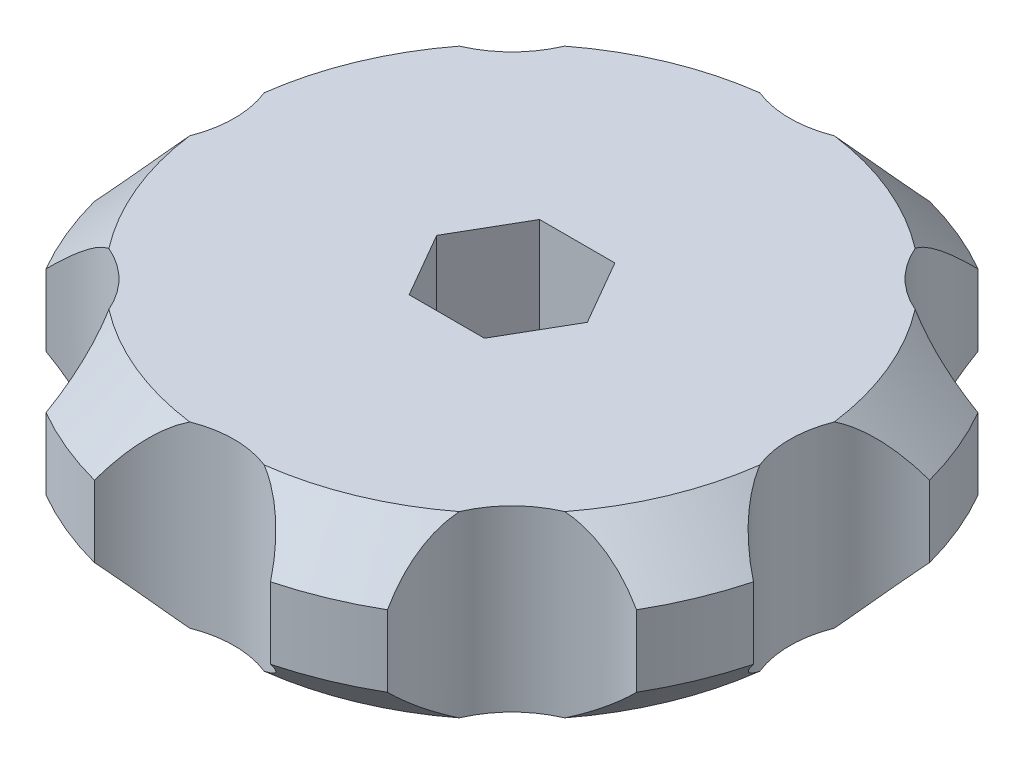
from build123d import *

# Parameters (mm, degrees)
BOSS_EXTRUDE1_DEPTH = 10
CHAMFER1_SIZE       = 3
CUT_EXTRUDE1_DEPTH  = 28.935018749


with BuildPart() as part:
    # Sketch1 → Boss-Extrude1 (new body)
    with BuildSketch(Plane(origin=(0, 0, 0), x_dir=(1, 0, 0), z_dir=(0, 1, 0))):
        with BuildLine():
            ThreePointArc((4.929173178, -18.444040543), (0, -15.55551692), (-4.929173178, -18.444040543))
            ThreePointArc((-4.929173178, -18.444040543), (-7.30594069, -17.6381011), (-9.556454361, -16.527357921))
            ThreePointArc((-9.556454361, -16.527357921), (-10.999411499, -10.999411499), (-16.527357921, -9.556454361))
            ThreePointArc((-16.527357921, -9.556454361), (-17.6381011, -7.30594069), (-18.444040543, -4.929173178))
            ThreePointArc((-18.444040543, -4.929173178), (-15.55551692, 0), (-18.444040543, 4.929173178))
            ThreePointArc((-18.444040543, 4.929173178), (-17.6381011, 7.30594069), (-16.527357921, 9.556454361))
            ThreePointArc((-16.527357921, 9.556454361), (-10.999411499, 10.999411499), (-9.556454361, 16.527357921))
            ThreePointArc((-9.556454361, 16.527357921), (-7.30594069, 17.6381011), (-4.929173178, 18.444040543))
            ThreePointArc((-4.929173178, 18.444040543), (0, 15.55551692), (4.929173178, 18.444040543))
            ThreePointArc((4.929173178, 18.444040543), (7.30594069, 17.6381011), (9.556454361, 16.527357921))
            ThreePointArc((9.556454361, 16.527357921), (10.999411499, 10.999411499), (16.527357921, 9.556454361))
            ThreePointArc((16.527357921, 9.556454361), (17.6381011, 7.30594069), (18.444040543, 4.929173178))
            ThreePointArc((18.444040543, 4.929173178), (15.55551692, 0), (18.444040543, -4.929173178))
            ThreePointArc((18.444040543, -4.929173178), (17.6381011, -7.30594069), (16.527357921, -9.556454361))
            ThreePointArc((16.527357921, -9.556454361), (10.999411499, -10.999411499), (9.556454361, -16.527357921))
            ThreePointArc((9.556454361, -16.527357921), (7.30594069, -17.6381011), (4.929173178, -18.444040543))
        make_face()
    extrude(amount=BOSS_EXTRUDE1_DEPTH)

    # Chamfer1
    chamfer1_edges = [part.edges().sort_by_distance(p)[0] for p in [
        (-7.30594069, 0, -17.6381011),
        (7.30594069, 0, -17.6381011),
        (17.6381011, 0, -7.30594069),
        (17.6381011, 0, 7.30594069),
        (7.30594069, 0, 17.6381011),
        (-7.30594069, 0, 17.6381011),
        (-17.6381011, 0, 7.30594069),
        (-17.6381011, 0, -7.30594069),
        (-17.6381011, 10, -7.30594069),
        (-7.30594069, 10, -17.6381011),
        (7.30594069, 10, -17.6381011),
        (17.6381011, 10, -7.30594069),
        (17.6381011, 10, 7.30594069),
        (7.30594069, 10, 17.6381011),
        (-7.30594069, 10, 17.6381011),
        (-17.6381011, 10, 7.30594069),
    ]]
    chamfer(chamfer1_edges, length=CHAMFER1_SIZE)

    # Sketch2 → Cut-Extrude1 (cut, through all)
    with BuildSketch(Plane(origin=(0, 10, 0), x_dir=(1, 0, 0), z_dir=(0, 1, 0))):
        Polygon((-2.107328483, -3.65), (2.107328483, -3.65), (4.214656965, 0), (2.107328483, 3.65), (-2.107328483, 3.65), (-4.214656965, 0), align=None)
    extrude(amount=-CUT_EXTRUDE1_DEPTH, mode=Mode.SUBTRACT)


solid = part.part
